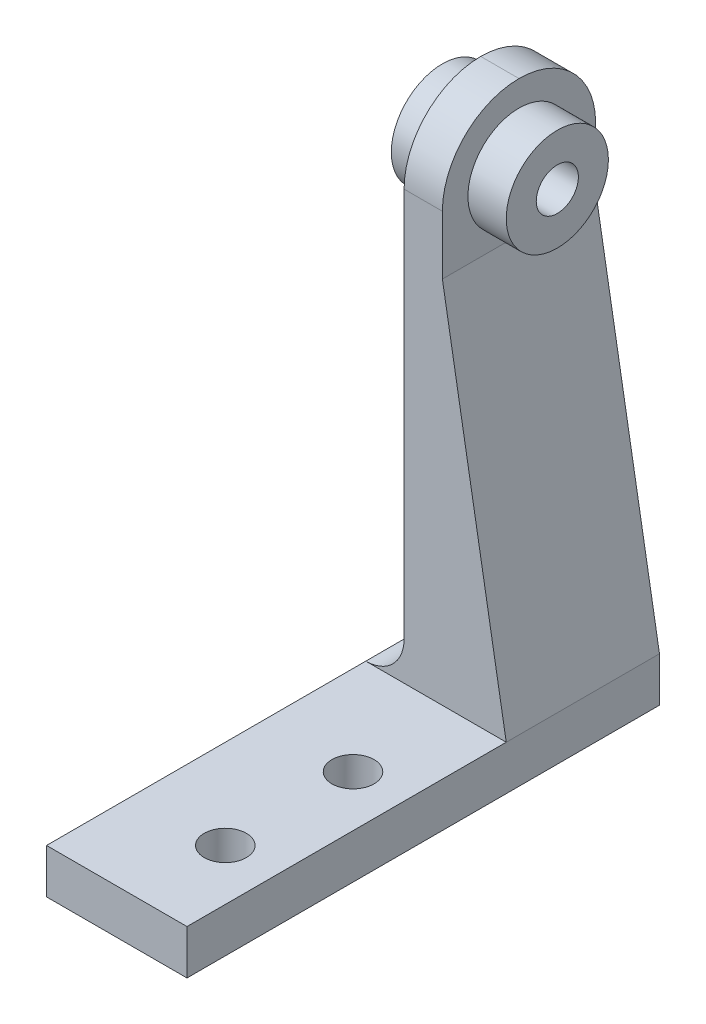
from build123d import *

# Parameters (mm, degrees)
SKETCH_1_W          = 12
SKETCH_1_H          = 40
SKETCH_1_R          = 1.65
EXTRUDE_1_DEPTH     = 3
FILLET_1_R          = 6
SKETCH_2_R          = 4
SKETCH_2_R_2        = 1.65
EXTRUDE_2_DEPTH     = 3
EXTRUDE_START       = 3
SKETCH_3_R          = 4
SKETCH_3_R_2        = 1.65
EXTRUDE_3_DEPTH     = 3
SKETCH_4_W          = 3
SKETCH_4_H          = 12
EXTRUDE_4_DEPTH     = 3
SKETCH_5_W          = 3
SKETCH_5_H          = 3.489872662
EXTRUDE_5_DEPTH     = 37
SKETCH_8_W          = 37
SKETCH_8_H          = 3.489872662
EXTRUDE_8_DEPTH     = 5
SKETCH_9_W          = 37
SKETCH_9_H          = 3.489872662
EXTRUDE_9_DEPTH     = 3
SKETCH_10_W         = 12
SKETCH_10_H         = 28.910754844
EXTRUDE_10_DEPTH    = 5
FILLET_2_R          = 3
SKETCH_13_R         = 1.65
CUT_EXTRUDE_2_DEPTH = 4
CUT_EXTRUDE_3_DEPTH = 12


with BuildPart() as part:
    # 草图1 → 凸台-拉伸1 (new body)
    with BuildSketch(Plane(origin=(0, 0, 0), x_dir=(0, 0, -1), z_dir=(1, 0, 0))):
        Rectangle(SKETCH_1_W, SKETCH_1_H)
        with Locations((0, 14)):
            Circle(SKETCH_1_R, mode=Mode.SUBTRACT)
    extrude(amount=EXTRUDE_1_DEPTH)

    # 圆角1
    fillet_1_edges = [part.edges().sort_by_distance(p)[0] for p in [
        (1.5, 20, -6),
        (1.5, 20, 6),
    ]]
    fillet(fillet_1_edges, radius=FILLET_1_R - 0.0001)  # a hair under: the kernel refuses the full size

    # 草图2 → 凸台-拉伸2 (add)
    with BuildSketch(Plane(origin=(3, 0, 0), x_dir=(0, 0, -1), z_dir=(1, 0, 0))):
        with Locations((0, 14)):
            Circle(SKETCH_2_R)
        with Locations((0, 14)):
            Circle(SKETCH_2_R_2, mode=Mode.SUBTRACT)
    extrude(amount=EXTRUDE_2_DEPTH)

    # 草图3 → 凸台-拉伸3 (add)
    with BuildSketch(Plane.ZY.offset(EXTRUDE_START)):
        with Locations(Location((0, 14, 0), (0, 0, 180))):
            Circle(SKETCH_3_R)
        with Locations((0, 14)):
            Circle(SKETCH_3_R_2, mode=Mode.SUBTRACT)
    extrude(amount=-EXTRUDE_3_DEPTH)

    # 草图4 → 凸台-拉伸4 (add)
    with BuildSketch(Plane.XZ.offset(20)):
        with Locations((1.5, 0)):
            Rectangle(SKETCH_4_W, SKETCH_4_H)
    extrude(amount=EXTRUDE_4_DEPTH)

    # 草图5 → 凸台-拉伸5 (add)
    with BuildSketch(Plane(origin=(0, 0, -6), x_dir=(-1, 0, 0), z_dir=(0, 0, -1))):
        with Locations((-1.5, -21.255063669)):
            Rectangle(SKETCH_5_W, SKETCH_5_H)
    extrude(amount=-EXTRUDE_5_DEPTH)

    # 草图8 → 凸台-拉伸8 (add)
    with BuildSketch(Plane(origin=(3, 0, 0), x_dir=(0, 0, -1), z_dir=(1, 0, 0))):
        with Locations((-12.5, -21.255063669)):
            Rectangle(SKETCH_8_W, SKETCH_8_H)
    extrude(amount=EXTRUDE_8_DEPTH)

    # 草图9 → 凸台-拉伸9 (add)
    with BuildSketch(Plane.ZY):
        with Locations((12.5, -21.255063669)):
            Rectangle(SKETCH_9_W, SKETCH_9_H)
    extrude(amount=EXTRUDE_9_DEPTH)

    # 草图10 → 凸台-拉伸10 (add)
    with BuildSketch(Plane(origin=(3, 0, 0), x_dir=(0, 0, -1), z_dir=(1, 0, 0))):
        with Locations((0, -5.054749916)):
            Rectangle(SKETCH_10_W, SKETCH_10_H)
    extrude(amount=EXTRUDE_10_DEPTH)

    # 圆角2
    fillet_2_edges = [part.edges().sort_by_distance(p)[0] for p in [
        (0, -19.510127338, 0),
    ]]
    fillet(fillet_2_edges, radius=FILLET_2_R - 0.0001)  # a hair under: the kernel refuses the full size

    # 草图13 → 切除-拉伸2 (cut)
    with BuildSketch(Plane(origin=(0, -19.510127338, 0), x_dir=(1, 0, 0), z_dir=(0, 1, 0))):
        with Locations(Location((4, -14, 0), (0, 0, 270))):
            Circle(SKETCH_13_R)
        with Locations(Location((4, -24, 0), (0, 0, 270))):
            Circle(SKETCH_13_R)
    extrude(amount=-CUT_EXTRUDE_2_DEPTH, mode=Mode.SUBTRACT)

    # 草图15 → 切除-拉伸3 (cut)
    with BuildSketch(Plane.XY.offset(6)):
        Polygon((3, 9.400627506), (8, -19.510127338), (8, 9.400627506), align=None)
    extrude(amount=-CUT_EXTRUDE_3_DEPTH, mode=Mode.SUBTRACT)


solid = part.part
